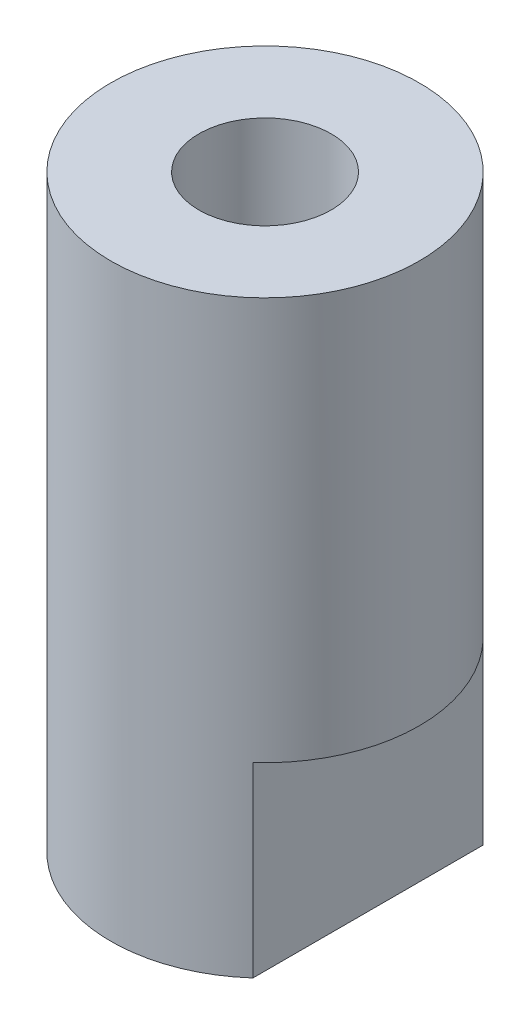
from build123d import *

# Parameters (mm, degrees)
SKETCH1_R                  = 10.5
BOSS_EXTRUDE1_DEPTH        = 40.1
M10X1_0_TAPPED_HOLE1_D     = 9
M10X1_0_TAPPED_HOLE1_DEPTH = 23
M10X1_0_TAPPED_HOLE1_TIP   = 2.703872786
M8X1_0_TAPPED_HOLE1_D      = 7
M8X1_0_TAPPED_HOLE1_DEPTH  = 19
M8X1_0_TAPPED_HOLE1_TIP    = 2.103012167
CUT_EXTRUDE1_DEPTH         = 43.761080435
CUT_EXTRUDE1_DEPTH_BACK    = 43.761080435
SKETCH6_W                  = 3.5
SKETCH6_H                  = 12.7


with BuildPart() as part:
    # Sketch1 → Boss-Extrude1 (new body)
    with BuildSketch(Plane(origin=(0, 0, 0), x_dir=(1, 0, 0), z_dir=(0, 1, 0))):
        Circle(SKETCH1_R)
    extrude(amount=BOSS_EXTRUDE1_DEPTH)

    # M10x1.0 Tapped Hole1
    with Locations(Plane(origin=(0, 40.1, 0), x_dir=(1, 0, 0), z_dir=(0, 1, 0))):
        with Locations((0, 0)):
            Hole(M10X1_0_TAPPED_HOLE1_D / 2, depth=M10X1_0_TAPPED_HOLE1_DEPTH)
            with Locations((0, 0, -(M10X1_0_TAPPED_HOLE1_DEPTH + M10X1_0_TAPPED_HOLE1_TIP / 2))):  # 118° drill point
                Cone(0, M10X1_0_TAPPED_HOLE1_D / 2, M10X1_0_TAPPED_HOLE1_TIP, mode=Mode.SUBTRACT)

    # M8x1.0 Tapped Hole1
    with Locations(Plane(origin=(0, 0, 0), x_dir=(-1, 0, 0), z_dir=(0, -1, 0))):
        with Locations((0, 0)):
            Hole(M8X1_0_TAPPED_HOLE1_D / 2, depth=M8X1_0_TAPPED_HOLE1_DEPTH)
            with Locations((0, 0, -(M8X1_0_TAPPED_HOLE1_DEPTH + M8X1_0_TAPPED_HOLE1_TIP / 2))):  # 118° drill point
                Cone(0, M8X1_0_TAPPED_HOLE1_D / 2, M8X1_0_TAPPED_HOLE1_TIP, mode=Mode.SUBTRACT)

    # Sketch6 → Cut-Extrude1 (cut, two sides: drawn at the far end of the back side and taken through both)
    with BuildSketch(Plane.XY.offset(-CUT_EXTRUDE1_DEPTH_BACK)):
        with Locations((-8.75, 6.35)):
            Rectangle(SKETCH6_W, SKETCH6_H)
        with Locations((8.75, 6.35)):
            Rectangle(SKETCH6_W, SKETCH6_H)
    extrude(amount=CUT_EXTRUDE1_DEPTH + CUT_EXTRUDE1_DEPTH_BACK, mode=Mode.SUBTRACT)


solid = part.part
